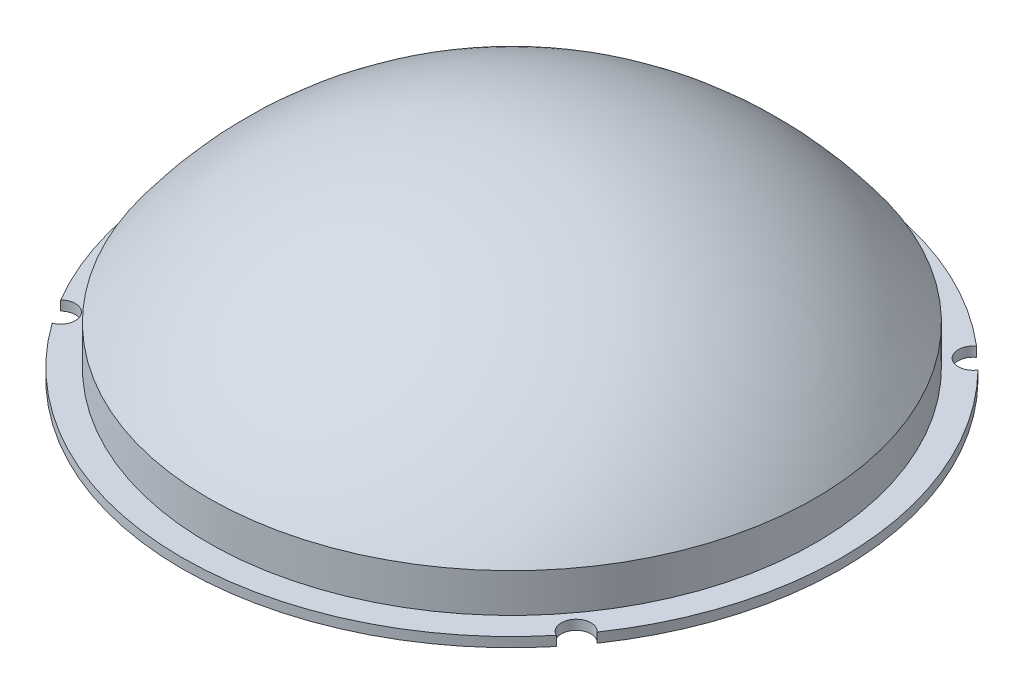
from build123d import *

# Parameters (mm, degrees)
SKETCH1_R           = 59.69
DOME_BASE_DEPTH     = 9.525
DOME1_FACE_RADIUS   = 59.69
DOME1_HEIGHT        = 30.48
SKETCH2_R           = 64.77
SKETCH2_R_2         = 59.69
BOSS_EXTRUDE2_DEPTH = 1.905
SKETCH3_R           = 2.921
CUT_EXTRUDE1_DEPTH  = 100.206430235


# Read off the part's stored shape, not the designer's step: Shell1
with BuildPart() as part:
    # Sketch1 → Dome Base (new body)
    with BuildSketch(Plane(origin=(0, 0, 0), x_dir=(1, 0, 0), z_dir=(0, 1, 0))):
        with Locations(Location((0, 0, 0), (0, 0, 90))):
            Circle(SKETCH1_R)
    extrude(amount=DOME_BASE_DEPTH)

    # Dome1: a dome of height H over a round flat face of radius A is a cap of a sphere of radius (A * A + H * H) / (2 * H)
    dome1_r = (DOME1_FACE_RADIUS * DOME1_FACE_RADIUS + DOME1_HEIGHT * DOME1_HEIGHT) / (2 * DOME1_HEIGHT)
    dome1_base = Plane((0, 9.525, 0), z_dir=(0, 1, 0))
    with Locations(dome1_base.offset(DOME1_HEIGHT - dome1_r)):
        dome1_ball = Sphere(dome1_r, mode=Mode.PRIVATE)
    add(split(dome1_ball, bisect_by=dome1_base, keep=Keep.TOP, mode=Mode.PRIVATE))

    # Shell1 outline → Shell1 (revolve, cut)
    with BuildSketch(Plane.XY):
        with BuildLine():
            Line((57.785, 0), (57.785000043, 8.9034161))
            ThreePointArc((57.785000043, 8.9034161), (32.371077914, 30.386404711), (0, 38.1))
            Line((0, 38.1), (0, 0))
            Line((0, 0), (57.785, 0))
        make_face()
    revolve(axis=Axis((0, 0, 0), (0, 1, 0)), mode=Mode.SUBTRACT)

    # Sketch2 → Boss-Extrude2 (add)
    with BuildSketch(Plane.XZ):
        with Locations(Location((0, 0, 0), (0, 0, 270))):
            Circle(SKETCH2_R)
        with Locations(Location((0, 0, 0), (0, 0, 270))):
            Circle(SKETCH2_R_2, mode=Mode.SUBTRACT)
    extrude(amount=-BOSS_EXTRUDE2_DEPTH)

    # Sketch3 → Cut-Extrude1 (cut, through all)
    with BuildSketch(Plane(origin=(0, 1.905, 0), x_dir=(1, 0, 0), z_dir=(0, 1, 0))):
        with Locations((-53.788136875, -34.930424511)):
            Circle(SKETCH3_R)
        with Locations((51.220488437, -38.59740651)):
            Circle(SKETCH3_R)
        with Locations((-41.225183347, 49.130260359)):
            Circle(SKETCH3_R)
        with Locations((43.739964823, 46.905369653)):
            Circle(SKETCH3_R)
    extrude(amount=-CUT_EXTRUDE1_DEPTH, mode=Mode.SUBTRACT)


solid = part.part
